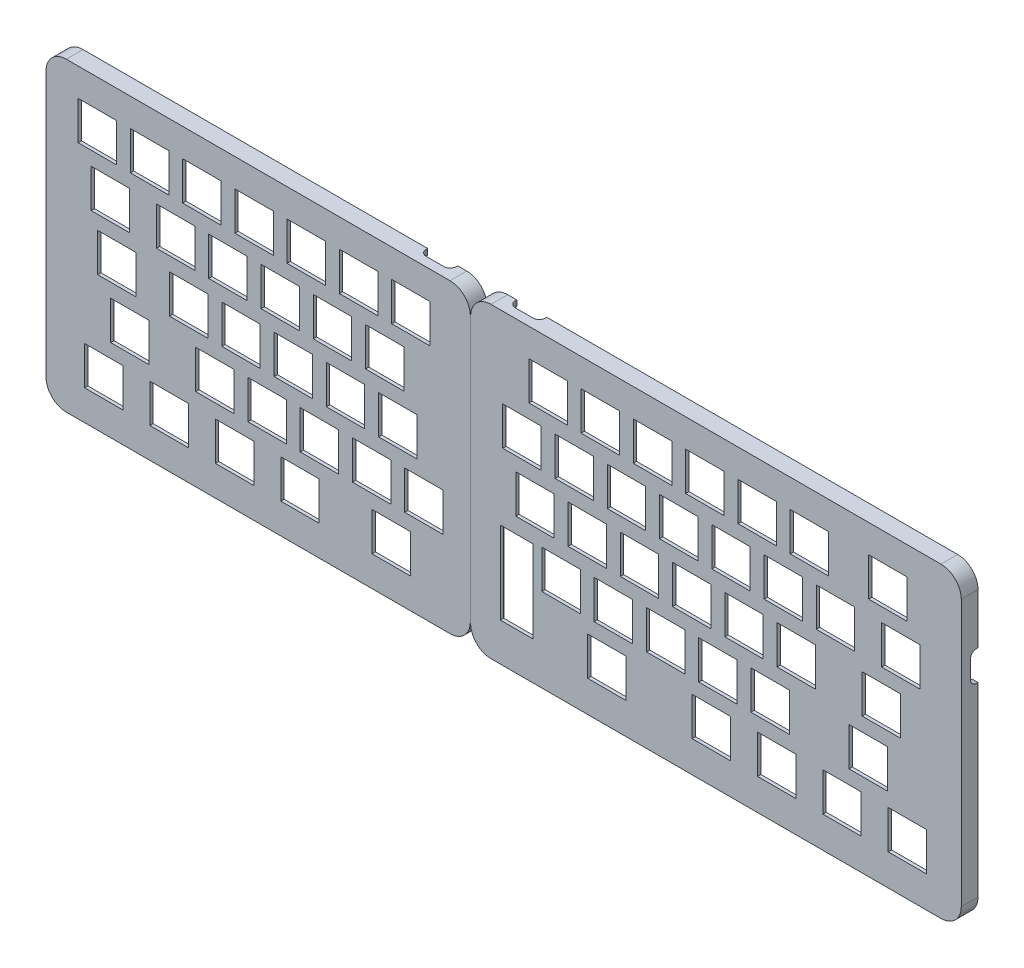
from build123d import *
from OCP.BRepAlgoAPI import BRepAlgoAPI_Cut
from OCP.TopTools import TopTools_ListOfShape

# Parameters (mm, degrees)
BOSS_EXTRUDE1_DEPTH                  = 1.2
BOSS_EXTRUDE1_2_DEPTH                = 1.2
SKETCH3_W                            = 14
SKETCH3_H                            = 14
CUT_EXTRUDE1_DEPTH                   = 1.2
BOSS_EXTRUDE2_DEPTH                  = 2.9
BOSS_EXTRUDE2_DEPTH_BACK             = 2
CUT_EXTRUDE2_DEPTH                   = 3.6
CUT_EXTRUDE3_DEPTH                   = 6
CUT_EXTRUDE4_START                   = -0.629226
CUT_EXTRUDE4_DEPTH                   = 2.133976
CUT_EXTRUDE5_DEPTH                   = 1.5
F_3_3_3_3_DIAMETER_HOLE1_AT_2_COUNT  = 2
F_3_3_3_3_DIAMETER_HOLE1_AT_2_PITCH  = 84.687594078
F_3_3_3_3_DIAMETER_HOLE1_AT_3_COUNT  = 2
F_3_3_3_3_DIAMETER_HOLE1_AT_3_PITCH  = 169.339250001
F_3_3_3_3_DIAMETER_HOLE1_AT_4_COUNT  = 2
F_3_3_3_3_DIAMETER_HOLE1_AT_4_PITCH  = 251.541091795
F_3_3_3_3_DIAMETER_HOLE1_AT_5_COUNT  = 2
F_3_3_3_3_DIAMETER_HOLE1_AT_5_PITCH  = 324.12
F_3_3_3_3_DIAMETER_HOLE1_AT_6_COUNT  = 2
F_3_3_3_3_DIAMETER_HOLE1_AT_6_PITCH  = 329.830375734
F_3_3_3_3_DIAMETER_HOLE1_AT_7_COUNT  = 2
F_3_3_3_3_DIAMETER_HOLE1_AT_7_PITCH  = 339.76617419
F_3_3_3_3_DIAMETER_HOLE1_AT_8_COUNT  = 2
F_3_3_3_3_DIAMETER_HOLE1_AT_8_PITCH  = 272.060494349
F_3_3_3_3_DIAMETER_HOLE1_AT_9_COUNT  = 2
F_3_3_3_3_DIAMETER_HOLE1_AT_9_PITCH  = 205.937809117
F_3_3_3_3_DIAMETER_HOLE1_AT_10_COUNT = 2
F_3_3_3_3_DIAMETER_HOLE1_AT_10_PITCH = 178.95
F_3_3_3_3_DIAMETER_HOLE1_AT_11_COUNT = 2
F_3_3_3_3_DIAMETER_HOLE1_AT_11_PITCH = 134.18391184
F_3_3_3_3_DIAMETER_HOLE1_AT_12_COUNT = 2
F_3_3_3_3_DIAMETER_HOLE1_AT_12_PITCH = 197.865862839
F_3_3_3_3_DIAMETER_HOLE1_AT_13_COUNT = 2
F_3_3_3_3_DIAMETER_HOLE1_AT_13_PITCH = 102.347999613
F_3_3_3_3_DIAMETER_HOLE1_AT_14_COUNT = 2
F_3_3_3_3_DIAMETER_HOLE1_AT_14_PITCH = 51.203766263
F_3_3_3_3_DIAMETER_HOLE1_AT_15_COUNT = 2
F_3_3_3_3_DIAMETER_HOLE1_AT_15_PITCH = 178.57853914
SKETCH11_W                           = 12.000000248
SKETCH11_H                           = 30
CUT_EXTRUDE_OLED_DEPTH               = 1.2


with BuildPart() as part:
    # Sketch2 → Boss-Extrude1 (new body)
    with BuildSketch(Plane.XY.offset(4.1)):
        with BuildLine():
            ThreePointArc((133.78, 95.545005864), (131.612590078, 100.777590078), (126.380005864, 102.945))
            Line((126.380005864, 102.945), (-13.490000824, 102.945))
            ThreePointArc((-13.490000824, 102.945), (-18.722587075, 100.77759308), (-20.89, 95.545009317))
            Line((-20.89, 95.545009317), (-20.89, -1.072999648))
            ThreePointArc((-20.89, -1.072999648), (-18.722593496, -6.305586659), (-13.490009317, -8.473))
            Line((-13.490009317, -8.473), (126.380000824, -8.473))
            ThreePointArc((126.380000824, -8.473), (131.612587075, -6.30559308), (133.78, -1.073009317))
            Line((133.78, -1.073009317), (133.78, 95.545005864))
        make_face()
    extrude(amount=-BOSS_EXTRUDE1_DEPTH)


with BuildPart() as body_2:
    # Sketch2 → Boss-Extrude1 2 (new body)
    with BuildSketch(Plane.XY.offset(4.1)):
        with BuildLine():
            ThreePointArc((141.290747469, 102.945), (136.058157566, 100.777589721), (133.89075, 95.544998695))
            Line((133.89075, 95.544998695), (133.89075002, -1.502703691))
            ThreePointArc((133.89075002, -1.502703691), (136.058071049, -6.735635188), (141.290974478, -8.903023987))
            Line((141.290974478, -8.903023987), (305.330003548, -8.903))
            ThreePointArc((305.330003548, -8.903), (310.562592793, -6.735589362), (312.73, -1.502998695))
            Line((312.73, -1.502998695), (312.73, 95.545002531))
            ThreePointArc((312.73, 95.545002531), (310.562589721, 100.777592434), (305.329998695, 102.945))
            Line((305.329998695, 102.945), (141.290747469, 102.945))
        make_face()
    extrude(amount=-BOSS_EXTRUDE1_2_DEPTH)


with BuildPart() as cut_extrude1_tool:
    # Sketch3 → Cut-Extrude1 (new body)
    with BuildSketch(Plane.XY.offset(4.1)):
        with Locations((245.45825, 9.525)):
            Rectangle(SKETCH3_W, SKETCH3_H)
        with Locations((221.64575, 9.525)):
            Rectangle(SKETCH3_W, SKETCH3_H)
        with Locations((183.54575, 9.525)):
            Rectangle(SKETCH3_W, SKETCH3_H)
        with Locations((78.767545, 28.582)):
            Rectangle(SKETCH3_W, SKETCH3_H)
        with Locations((293.08325, 9.525)):
            Rectangle(SKETCH3_W, SKETCH3_H)
        with Locations((269.27075, 9.525)):
            Rectangle(SKETCH3_W, SKETCH3_H)
        with Locations((97.817545, 28.582)):
            Rectangle(SKETCH3_W, SKETCH3_H)
        with Locations((283.55825, 47.625)):
            Rectangle(SKETCH3_W, SKETCH3_H)
        with Locations((166.877, 28.575)):
            Rectangle(SKETCH3_W, SKETCH3_H)
        with Locations((116.867545, 28.582)):
            Rectangle(SKETCH3_W, SKETCH3_H)
        with Locations((152.5895, 66.675)):
            Rectangle(SKETCH3_W, SKETCH3_H)
        with Locations((185.927, 28.575)):
            Rectangle(SKETCH3_W, SKETCH3_H)
        with Locations((4.948795, 47.632)):
            Rectangle(SKETCH3_W, SKETCH3_H)
        with Locations((171.6395, 66.675)):
            Rectangle(SKETCH3_W, SKETCH3_H)
        with Locations((204.977, 28.575)):
            Rectangle(SKETCH3_W, SKETCH3_H)
        with Locations((31.142545, 47.632)):
            Rectangle(SKETCH3_W, SKETCH3_H)
        with Locations((190.6895, 66.675)):
            Rectangle(SKETCH3_W, SKETCH3_H)
        with Locations((224.027, 28.575)):
            Rectangle(SKETCH3_W, SKETCH3_H)
        with Locations((50.192545, 47.632)):
            Rectangle(SKETCH3_W, SKETCH3_H)
        with Locations((228.7895, 66.675)):
            Rectangle(SKETCH3_W, SKETCH3_H)
        with Locations((209.7395, 66.675)):
            Rectangle(SKETCH3_W, SKETCH3_H)
        with Locations((243.077, 28.575)):
            Rectangle(SKETCH3_W, SKETCH3_H)
        with Locations((69.242545, 47.632)):
            Rectangle(SKETCH3_W, SKETCH3_H)
        with Locations((266.8895, 66.675)):
            Rectangle(SKETCH3_W, SKETCH3_H)
        with Locations((247.8395, 66.675)):
            Rectangle(SKETCH3_W, SKETCH3_H)
        with Locations((278.79575, 28.575)):
            Rectangle(SKETCH3_W, SKETCH3_H)
        with Locations((88.292545, 47.632)):
            Rectangle(SKETCH3_W, SKETCH3_H)
        with Locations((162.1145, 85.725)):
            Rectangle(SKETCH3_W, SKETCH3_H)
        with Locations((290.702, 66.675)):
            Rectangle(SKETCH3_W, SKETCH3_H)
        with Locations((107.342545, 47.632)):
            Rectangle(SKETCH3_W, SKETCH3_H)
        with Locations((200.2145, 85.725)):
            Rectangle(SKETCH3_W, SKETCH3_H)
        with Locations((181.1645, 85.725)):
            Rectangle(SKETCH3_W, SKETCH3_H)
        with Locations((2.567545, 66.682)):
            Rectangle(SKETCH3_W, SKETCH3_H)
        with Locations((238.3145, 85.725)):
            Rectangle(SKETCH3_W, SKETCH3_H)
        with Locations((219.2645, 85.725)):
            Rectangle(SKETCH3_W, SKETCH3_H)
        with Locations((157.352, 47.625)):
            Rectangle(SKETCH3_W, SKETCH3_H)
        with Locations((26.380045, 66.682)):
            Rectangle(SKETCH3_W, SKETCH3_H)
        with Locations((285.9395, 85.725)):
            Rectangle(SKETCH3_W, SKETCH3_H)
        with Locations((257.3645, 85.725)):
            Rectangle(SKETCH3_W, SKETCH3_H)
        with Locations((64.480045, 66.682)):
            Rectangle(SKETCH3_W, SKETCH3_H)
        with Locations((45.430045, 66.682)):
            Rectangle(SKETCH3_W, SKETCH3_H)
        with Locations((23.998795, 9.532)):
            Rectangle(SKETCH3_W, SKETCH3_H)
        with Locations((0.186295, 9.532)):
            Rectangle(SKETCH3_W, SKETCH3_H)
        with Locations((176.402, 47.625)):
            Rectangle(SKETCH3_W, SKETCH3_H)
        with Locations((102.580045, 66.682)):
            Rectangle(SKETCH3_W, SKETCH3_H)
        with Locations((83.530045, 66.682)):
            Rectangle(SKETCH3_W, SKETCH3_H)
        with Locations((71.687295, 9.532)):
            Rectangle(SKETCH3_W, SKETCH3_H)
        with Locations((47.874795, 9.532)):
            Rectangle(SKETCH3_W, SKETCH3_H)
        with Locations((16.855045, 85.732)):
            Rectangle(SKETCH3_W, SKETCH3_H)
        with Locations((-2.194955, 85.732)):
            Rectangle(SKETCH3_W, SKETCH3_H)
        with Locations((104.961295, 9.532)):
            Rectangle(SKETCH3_W, SKETCH3_H)
        with Locations((195.452, 47.625)):
            Rectangle(SKETCH3_W, SKETCH3_H)
        with Locations((54.955045, 85.732)):
            Rectangle(SKETCH3_W, SKETCH3_H)
        with Locations((35.905045, 85.732)):
            Rectangle(SKETCH3_W, SKETCH3_H)
        with Locations((9.711295, 28.582)):
            Rectangle(SKETCH3_W, SKETCH3_H)
        with Locations((112.105045, 85.732)):
            Rectangle(SKETCH3_W, SKETCH3_H)
        with Locations((93.055045, 85.732)):
            Rectangle(SKETCH3_W, SKETCH3_H)
        with Locations((74.005045, 85.732)):
            Rectangle(SKETCH3_W, SKETCH3_H)
        with Locations((59.717545, 28.582)):
            Rectangle(SKETCH3_W, SKETCH3_H)
        with Locations((40.667545, 28.582)):
            Rectangle(SKETCH3_W, SKETCH3_H)
        with Locations((252.602, 47.625)):
            Rectangle(SKETCH3_W, SKETCH3_H)
        with Locations((233.552, 47.625)):
            Rectangle(SKETCH3_W, SKETCH3_H)
        with Locations((214.502, 47.625)):
            Rectangle(SKETCH3_W, SKETCH3_H)
    extrude(amount=-CUT_EXTRUDE1_DEPTH)


with BuildPart() as part_1:
    add(part.part)

    # Cut-Extrude1: cut by cut_extrude1_tool
    add(cut_extrude1_tool.part, mode=Mode.SUBTRACT)


with BuildPart() as body_2_1:
    add(body_2.part)

    # Cut-Extrude1: cut by cut_extrude1_tool
    add(cut_extrude1_tool.part, mode=Mode.SUBTRACT)

    # Sketch4 → Boss-Extrude2 (add, two sides: drawn at the far end of the back side and taken through both)
    # profile 1 of 2: a face of its own
    with BuildSketch(Plane.XY.offset(-BOSS_EXTRUDE2_DEPTH_BACK)):
        with BuildLine():
            ThreePointArc((133.78, 95.545005864), (131.612590078, 100.777590078), (126.380005864, 102.945))
            Line((126.380005864, 102.945), (-13.490000824, 102.945))
            ThreePointArc((-13.490000824, 102.945), (-18.722587075, 100.77759308), (-20.89, 95.545009317))
            Line((-20.89, 95.545009317), (-20.89, -1.072999648))
            ThreePointArc((-20.89, -1.072999648), (-18.722593496, -6.305586659), (-13.490009317, -8.473))
            Line((-13.490009317, -8.473), (126.380000824, -8.473))
            ThreePointArc((126.380000824, -8.473), (131.612587075, -6.30559308), (133.78, -1.073009317))
            Line((133.78, -1.073009317), (133.78, 95.545005864))
        make_face()
        with BuildLine():
            Line((-13.490000824, 96.945), (126.380000824, 96.945))
            ThreePointArc((126.380000824, 96.945), (127.369949391, 96.534949391), (127.78, 95.545000824))
            Line((127.78, 95.545000824), (127.78, -1.073001477))
            ThreePointArc((127.78, -1.073001477), (127.36994916, -2.062949622), (126.380000824, -2.473))
            Line((126.380000824, -2.473), (-13.490001477, -2.473))
            ThreePointArc((-13.490001477, -2.473), (-14.479950037, -2.062948744), (-14.89, -1.072999648))
            Line((-14.89, -1.072999648), (-14.89, 95.545001477))
            ThreePointArc((-14.89, 95.545001477), (-14.47994916, 96.534949622), (-13.490000824, 96.945))
        make_face(mode=Mode.SUBTRACT)
    # profile 2 of 2: a face of its own
    with BuildSketch(Plane.XY.offset(-BOSS_EXTRUDE2_DEPTH_BACK)):
        with BuildLine():
            Line((305.329998695, 102.945), (141.290747469, 102.945))
            ThreePointArc((141.290747469, 102.945), (136.058157566, 100.777589721), (133.89075, 95.544998695))
            Line((133.89075, 95.544998695), (133.89075002, -1.502703691))
            ThreePointArc((133.89075002, -1.502703691), (136.058071049, -6.735635188), (141.290974478, -8.903023987))
            Line((141.290974478, -8.903023987), (305.330003548, -8.903))
            ThreePointArc((305.330003548, -8.903), (310.562592793, -6.735589362), (312.73, -1.502998695))
            Line((312.73, -1.502998695), (312.73, 95.545002531))
            ThreePointArc((312.73, 95.545002531), (310.562589721, 100.777592434), (305.329998695, 102.945))
        make_face()
        with BuildLine():
            Line((141.290747469, 96.945), (305.330002236, 96.945))
            ThreePointArc((305.330002236, 96.945), (306.319950286, 96.534950495), (306.73, 95.545002531))
            Line((306.73, 95.545002531), (306.73, -1.503002236))
            ThreePointArc((306.73, -1.503002236), (306.319950544, -2.492950237), (305.33000267, -2.903))
            Line((305.33000267, -2.903), (141.290693491, -2.903023998))
            ThreePointArc((141.290693491, -2.903023998), (140.300734781, -2.493017559), (139.890750002, -1.503049879))
            Line((139.890750002, -1.503049879), (139.89075, 95.545002236))
            ThreePointArc((139.89075, 95.545002236), (140.300799505, 96.534950286), (141.290747469, 96.945))
        make_face(mode=Mode.SUBTRACT)
    extrude(amount=BOSS_EXTRUDE2_DEPTH + BOSS_EXTRUDE2_DEPTH_BACK)


with BuildPart() as boss_extrude2_piece_1:
    # of the separate pieces the step leaves, piece 1, a body of its own (boss_extrude2_pieces)
    add(body_2_1.part.solids().sort_by_distance((141.290747469, 102.945, 4.1))[0])


with BuildPart() as boss_extrude2_piece_2:
    # of the separate pieces the step leaves, piece 2, a body of its own (boss_extrude2_pieces)
    add(body_2_1.part.solids().sort_by_distance((126.380000824, -8.473, 2.9))[0])


with BuildPart() as cut_extrude2_tool:
    # Sketch6 → Cut-Extrude2 (new body)
    with BuildSketch(Plane.XY.offset(1.6)):
        with BuildLine():
            Line((123.59, 96.945), (123.59, 99.945))
            ThreePointArc((123.59, 99.945), (123.297106391, 100.652106391), (122.59, 100.945))
            Line((122.59, 100.945), (112.590000667, 100.945))
            ThreePointArc((112.590000667, 100.945), (111.882893845, 100.652106626), (111.59, 99.945))
            Line((111.59, 99.945), (111.59, 96.945))
            Line((111.59, 96.945), (-13.490000824, 96.945))
            ThreePointArc((-13.490000824, 96.945), (-14.47994916, 96.534949622), (-14.89, 95.545001477))
            Line((-14.89, 95.545001477), (-14.89, 77.705))
            Line((-14.89, 77.705), (-17.889999333, 77.705))
            ThreePointArc((-17.889999333, 77.705), (-18.597106155, 77.412106626), (-18.89, 76.705))
            Line((-18.89, 76.705), (-18.89, 66.765000667))
            ThreePointArc((-18.89, 66.765000667), (-18.597106626, 66.057893845), (-17.89, 65.765))
            Line((-17.89, 65.765), (-14.89, 65.765))
            Line((-14.89, 65.765), (-14.89, -1.072999648))
            ThreePointArc((-14.89, -1.072999648), (-14.479950037, -2.062948744), (-13.490001477, -2.473))
            Line((-13.490001477, -2.473), (126.380000824, -2.473))
            ThreePointArc((126.380000824, -2.473), (127.36994916, -2.062949622), (127.78, -1.073001477))
            Line((127.78, -1.073001477), (127.78, 95.545000824))
            ThreePointArc((127.78, 95.545000824), (127.369949622, 96.53494916), (126.380001477, 96.945))
            Line((126.380001477, 96.945), (123.59, 96.945))
        make_face()
        with BuildLine():
            Line((156.08, 96.945), (156.08, 99.945))
            ThreePointArc((156.08, 99.945), (155.787106391, 100.652106391), (155.08, 100.945))
            Line((155.08, 100.945), (145.080000667, 100.945))
            ThreePointArc((145.080000667, 100.945), (144.372893845, 100.652106626), (144.08, 99.945))
            Line((144.08, 99.945), (144.08, 96.945))
            Line((144.08, 96.945), (141.290747469, 96.945))
            ThreePointArc((141.290747469, 96.945), (140.300799505, 96.534950286), (139.89075, 95.545002236))
            Line((139.89075, 95.545002236), (139.890750005, -1.503014757))
            ThreePointArc((139.890750005, -1.503014757), (140.300712315, -2.492995096), (141.290665073, -2.903024))
            Line((141.290665073, -2.903024), (305.33000267, -2.903))
            ThreePointArc((305.33000267, -2.903), (306.319950544, -2.492950237), (306.73, -1.503002236))
            Line((306.73, -1.503002236), (306.73, 65.765))
            Line((306.73, 65.765), (309.729999333, 65.765))
            ThreePointArc((309.729999333, 65.765), (310.437106155, 66.057893374), (310.73, 66.765))
            Line((310.73, 66.765), (310.73, 76.704999333))
            ThreePointArc((310.73, 76.704999333), (310.437106626, 77.412106155), (309.73, 77.705))
            Line((309.73, 77.705), (306.73, 77.705))
            Line((306.73, 77.705), (306.73, 95.545002531))
            ThreePointArc((306.73, 95.545002531), (306.319950286, 96.534950495), (305.330002236, 96.945))
            Line((305.330002236, 96.945), (156.08, 96.945))
        make_face()
    extrude(amount=-CUT_EXTRUDE2_DEPTH)


with BuildPart() as boss_extrude2_piece_1_1:
    add(boss_extrude2_piece_1.part)

    # Cut-Extrude2: cut by cut_extrude2_tool, with a tolerance
    cut_extrude2_stock = TopTools_ListOfShape()
    cut_extrude2_stock.Append(boss_extrude2_piece_1_1.part.wrapped)
    cut_extrude2_tools = TopTools_ListOfShape()
    cut_extrude2_tools.Append(cut_extrude2_tool.part.wrapped)
    cut_extrude2_cut = BRepAlgoAPI_Cut()
    cut_extrude2_cut.SetArguments(cut_extrude2_stock)
    cut_extrude2_cut.SetTools(cut_extrude2_tools)
    cut_extrude2_cut.SetFuzzyValue(0.00001)
    cut_extrude2_cut.Build()
    add(Compound.cast(cut_extrude2_cut.Shape()).solids(), mode=Mode.REPLACE)

    # Sketch7 → Cut-Extrude3 (cut)
    with BuildSketch(Plane(origin=(312.73, 0, 0), x_dir=(0, 0, -1), z_dir=(1, 0, 0))):
        with BuildLine():
            Line((1.485, 66.265), (2, 66.265))
            Line((2, 66.265), (2, 77.205))
            Line((2, 77.205), (1.485, 77.205))
            ThreePointArc((1.485, 77.205), (-0.105990258, 76.545990258), (-0.765, 74.955))
            Line((-0.765, 74.955), (-0.765, 73.003244897))
            Line((-0.765, 73.003244897), (-0.765, 71.023244897))
            Line((-0.765, 71.023244897), (-0.765, 68.515))
            ThreePointArc((-0.765, 68.515), (-0.105990258, 66.924009742), (1.485, 66.265))
        make_face()
        with BuildLine():
            ThreePointArc((2.145, 66.265), (3.735990258, 66.924009742), (4.395, 68.515))
            Line((4.395, 68.515), (4.395, 74.955))
            ThreePointArc((4.395, 74.955), (3.735990258, 76.545990258), (2.145, 77.205))
            Line((2.145, 77.205), (2, 77.205))
            Line((2, 77.205), (2, 66.265))
            Line((2, 66.265), (2.145, 66.265))
        make_face()
    extrude(amount=-CUT_EXTRUDE3_DEPTH, mode=Mode.SUBTRACT)


with BuildPart() as boss_extrude2_piece_2_1:
    add(boss_extrude2_piece_2.part)

    # Cut-Extrude2: cut by cut_extrude2_tool, with a tolerance
    cut_extrude2_2_stock = TopTools_ListOfShape()
    cut_extrude2_2_stock.Append(boss_extrude2_piece_2_1.part.wrapped)
    cut_extrude2_2_tools = TopTools_ListOfShape()
    cut_extrude2_2_tools.Append(cut_extrude2_tool.part.wrapped)
    cut_extrude2_2_cut = BRepAlgoAPI_Cut()
    cut_extrude2_2_cut.SetArguments(cut_extrude2_2_stock)
    cut_extrude2_2_cut.SetTools(cut_extrude2_2_tools)
    cut_extrude2_2_cut.SetFuzzyValue(0.00001)
    cut_extrude2_2_cut.Build()
    add(Compound.cast(cut_extrude2_2_cut.Shape()).solids(), mode=Mode.REPLACE)


with BuildPart() as part_2:
    add(part_1.part)

    # Combine1: union Boss-Extrude2 piece 2
    add(boss_extrude2_piece_2_1.part)

    # Sketch8 → Cut-Extrude4 (cut)
    with BuildSketch(Plane.ZY.offset(19.38525).offset(CUT_EXTRUDE4_START)):
        with BuildLine():
            Line((0.765, 71.466755103), (0.765, 74.955))
            ThreePointArc((0.765, 74.955), (0.105990258, 76.545990258), (-1.485, 77.205))
            Line((-1.485, 77.205), (-2.145, 77.205))
            ThreePointArc((-2.145, 77.205), (-3.735990258, 76.545990258), (-4.395, 74.955))
            Line((-4.395, 74.955), (-4.395, 68.515))
            ThreePointArc((-4.395, 68.515), (-3.735990258, 66.924009742), (-2.145, 66.265))
            Line((-2.145, 66.265), (-1.485, 66.265))
            ThreePointArc((-1.485, 66.265), (0.105990258, 66.924009742), (0.765, 68.515))
            Line((0.765, 68.515), (0.765, 71.446755103))
            Line((0.765, 71.446755103), (0.765, 71.466755103))
        make_face()
    extrude(amount=CUT_EXTRUDE4_DEPTH, mode=Mode.SUBTRACT)


with BuildPart() as cut_extrude5_tool:
    # Sketch9 → Cut-Extrude5 (new, symmetric)
    with BuildSketch(Plane(origin=(0, 101.445, 0), x_dir=(1, 0, 0), z_dir=(0, 1, 0))):
        with BuildLine():
            Line((146.86, -0.765), (153.3, -0.765))
            ThreePointArc((153.3, -0.765), (154.890990258, -0.105990258), (155.55, 1.485))
            Line((155.55, 1.485), (155.55, 2.145))
            ThreePointArc((155.55, 2.145), (154.890990258, 3.735990258), (153.3, 4.395))
            Line((153.3, 4.395), (146.86, 4.395))
            ThreePointArc((146.86, 4.395), (145.269009742, 3.735990258), (144.61, 2.145))
            Line((144.61, 2.145), (144.61, 1.485))
            ThreePointArc((144.61, 1.485), (145.269009742, -0.105990258), (146.86, -0.765))
        make_face()
        with BuildLine():
            ThreePointArc((123.06, 2.145), (122.400990258, 3.735990258), (120.81, 4.395))
            Line((120.81, 4.395), (114.37, 4.395))
            ThreePointArc((114.37, 4.395), (112.779009742, 3.735990258), (112.12, 2.145))
            Line((112.12, 2.145), (112.12, 1.485))
            ThreePointArc((112.12, 1.485), (112.779009742, -0.105990258), (114.37, -0.765))
            Line((114.37, -0.765), (120.81, -0.765))
            ThreePointArc((120.81, -0.765), (122.400990258, -0.105990258), (123.06, 1.485))
            Line((123.06, 1.485), (123.06, 2.145))
        make_face()
    extrude(amount=CUT_EXTRUDE5_DEPTH, both=True)


with BuildPart() as part_3:
    add(part_2.part)

    # Cut-Extrude5: cut by cut_extrude5_tool
    add(cut_extrude5_tool.part, mode=Mode.SUBTRACT)


with BuildPart() as boss_extrude2_piece_1_2:
    add(boss_extrude2_piece_1_1.part)

    # Cut-Extrude5: cut by cut_extrude5_tool
    add(cut_extrude5_tool.part, mode=Mode.SUBTRACT)

    # Sketch10 → Ø3.3 (3.3) Diameter Hole1 (revolve, cut)
    with BuildSketch(Plane(origin=(307.98, 98.195, -2), x_dir=(0, 1, 0), z_dir=(1, 0, 0))):
        Polygon((0, 0), (0, 4), (1.65, 3.008579979), (1.65, 0), align=None)
    f_3_3_3_3_diameter_hole1 = revolve(axis=Axis((307.98, 98.195, -8.35), (0, 0, 1)), mode=Mode.SUBTRACT)

    # Ø3.3 (3.3) Diameter Hole1 at 2: Ø3.3 (3.3) Diameter Hole1 ×2
    with Locations(*[Vector(-0.9997864729593883, 0.020664183686428278, 0) * (i * F_3_3_3_3_DIAMETER_HOLE1_AT_2_PITCH) for i in range(1, F_3_3_3_3_DIAMETER_HOLE1_AT_2_COUNT)]):
        add(f_3_3_3_3_diameter_hole1, mode=Mode.SUBTRACT)

    # Ø3.3 (3.3) Diameter Hole1 at 3: Ø3.3 (3.3) Diameter Hole1 ×2
    with Locations(*[(-i * F_3_3_3_3_DIAMETER_HOLE1_AT_3_PITCH, 0, 0) for i in range(1, F_3_3_3_3_DIAMETER_HOLE1_AT_3_COUNT)]):
        add(f_3_3_3_3_diameter_hole1, mode=Mode.SUBTRACT)

    # Ø3.3 (3.3) Diameter Hole1 at 11: Ø3.3 (3.3) Diameter Hole1 ×2
    with Locations(*[Vector(-0.6309959953878045, -0.7757860876585465, 0) * (i * F_3_3_3_3_DIAMETER_HOLE1_AT_11_PITCH) for i in range(1, F_3_3_3_3_DIAMETER_HOLE1_AT_11_COUNT)]):
        add(f_3_3_3_3_diameter_hole1, mode=Mode.SUBTRACT)

    # Ø3.3 (3.3) Diameter Hole1 at 12: Ø3.3 (3.3) Diameter Hole1 ×2
    with Locations(*[Vector(-0.8558285272149775, -0.5172596369378173, 0) * (i * F_3_3_3_3_DIAMETER_HOLE1_AT_12_PITCH) for i in range(1, F_3_3_3_3_DIAMETER_HOLE1_AT_12_COUNT)]):
        add(f_3_3_3_3_diameter_hole1, mode=Mode.SUBTRACT)

    # Ø3.3 (3.3) Diameter Hole1 at 13: Ø3.3 (3.3) Diameter Hole1 ×2
    with Locations(*[(0, -i * F_3_3_3_3_DIAMETER_HOLE1_AT_13_PITCH, 0) for i in range(1, F_3_3_3_3_DIAMETER_HOLE1_AT_13_COUNT)]):
        add(f_3_3_3_3_diameter_hole1, mode=Mode.SUBTRACT)

    # Ø3.3 (3.3) Diameter Hole1 at 14: Ø3.3 (3.3) Diameter Hole1 ×2
    with Locations(*[Vector(0.03417717343321745, -0.9994157897572541, 0) * (i * F_3_3_3_3_DIAMETER_HOLE1_AT_14_PITCH) for i in range(1, F_3_3_3_3_DIAMETER_HOLE1_AT_14_COUNT)]):
        add(f_3_3_3_3_diameter_hole1, mode=Mode.SUBTRACT)

    # Ø3.3 (3.3) Diameter Hole1 at 15: Ø3.3 (3.3) Diameter Hole1 ×2
    with Locations(*[Vector(-0.9580616507089157, -0.286562163310001, 0) * (i * F_3_3_3_3_DIAMETER_HOLE1_AT_15_PITCH) for i in range(1, F_3_3_3_3_DIAMETER_HOLE1_AT_15_COUNT)]):
        add(f_3_3_3_3_diameter_hole1, mode=Mode.SUBTRACT)

    # Sketch11 → Cut-Extrude_oled (cut)
    with BuildSketch(Plane.XY.offset(4.1)):
        with Locations((150.690735793, 19.996978253)):
            Rectangle(SKETCH11_W, SKETCH11_H)
    extrude(amount=-CUT_EXTRUDE_OLED_DEPTH, mode=Mode.SUBTRACT)


with BuildPart() as part_4:
    add(part_3.part)

    # Ø3.3 (3.3) Diameter Hole1 at 4: Ø3.3 (3.3) Diameter Hole1 ×2
    with Locations(*[Vector(-0.9999757989909713, 0.006957113795858436, 0) * (i * F_3_3_3_3_DIAMETER_HOLE1_AT_4_PITCH) for i in range(1, F_3_3_3_3_DIAMETER_HOLE1_AT_4_COUNT)]):
        add(f_3_3_3_3_diameter_hole1, mode=Mode.SUBTRACT)

    # Ø3.3 (3.3) Diameter Hole1 at 5: Ø3.3 (3.3) Diameter Hole1 ×2
    with Locations(*[(-i * F_3_3_3_3_DIAMETER_HOLE1_AT_5_PITCH, 0, 0) for i in range(1, F_3_3_3_3_DIAMETER_HOLE1_AT_5_COUNT)]):
        add(f_3_3_3_3_diameter_hole1, mode=Mode.SUBTRACT)

    # Ø3.3 (3.3) Diameter Hole1 at 6: Ø3.3 (3.3) Diameter Hole1 ×2
    with Locations(*[Vector(-0.9879926894986677, -0.15450063267569233, 0) * (i * F_3_3_3_3_DIAMETER_HOLE1_AT_6_PITCH) for i in range(1, F_3_3_3_3_DIAMETER_HOLE1_AT_6_COUNT)]):
        add(f_3_3_3_3_diameter_hole1, mode=Mode.SUBTRACT)

    # Ø3.3 (3.3) Diameter Hole1 at 7: Ø3.3 (3.3) Diameter Hole1 ×2
    with Locations(*[Vector(-0.9539501710913169, -0.2999651164299733, 0) * (i * F_3_3_3_3_DIAMETER_HOLE1_AT_7_PITCH) for i in range(1, F_3_3_3_3_DIAMETER_HOLE1_AT_7_COUNT)]):
        add(f_3_3_3_3_diameter_hole1, mode=Mode.SUBTRACT)

    # Ø3.3 (3.3) Diameter Hole1 at 8: Ø3.3 (3.3) Diameter Hole1 ×2
    with Locations(*[Vector(-0.924555418634432, -0.3810476057839888, 0) * (i * F_3_3_3_3_DIAMETER_HOLE1_AT_8_PITCH) for i in range(1, F_3_3_3_3_DIAMETER_HOLE1_AT_8_COUNT)]):
        add(f_3_3_3_3_diameter_hole1, mode=Mode.SUBTRACT)

    # Ø3.3 (3.3) Diameter Hole1 at 9: Ø3.3 (3.3) Diameter Hole1 ×2
    with Locations(*[Vector(-0.8689516547111712, -0.49489698097151247, 0) * (i * F_3_3_3_3_DIAMETER_HOLE1_AT_9_PITCH) for i in range(1, F_3_3_3_3_DIAMETER_HOLE1_AT_9_COUNT)]):
        add(f_3_3_3_3_diameter_hole1, mode=Mode.SUBTRACT)

    # Ø3.3 (3.3) Diameter Hole1 at 10: Ø3.3 (3.3) Diameter Hole1 ×2
    with Locations(*[(-i * F_3_3_3_3_DIAMETER_HOLE1_AT_10_PITCH, 0, 0) for i in range(1, F_3_3_3_3_DIAMETER_HOLE1_AT_10_COUNT)]):
        add(f_3_3_3_3_diameter_hole1, mode=Mode.SUBTRACT)


solid = Compound([boss_extrude2_piece_1_2.part, part_4.part])
